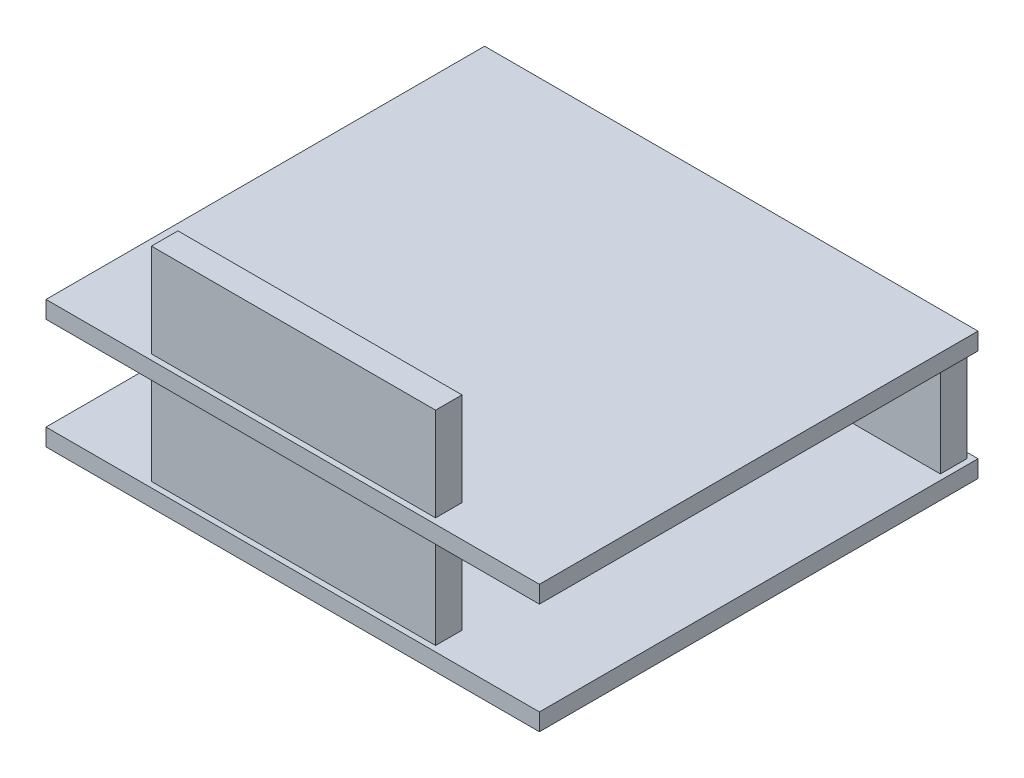
from build123d import *

# Parameters (mm, degrees)
SKETCH1_W           = 45
SKETCH1_H           = 40
BOSS_EXTRUDE1_DEPTH = 1.57
SKETCH2_W           = 25.91
SKETCH2_H           = 2.41
BOSS_EXTRUDE2_DEPTH = 8.51
SKETCH3_W           = 45
SKETCH3_H           = 40
BOSS_EXTRUDE3_DEPTH = 1.57
SKETCH4_W           = 25.91
SKETCH4_H           = 2.41
BOSS_EXTRUDE4_DEPTH = 8.51


with BuildPart() as part:
    # Sketch1 → Boss-Extrude1 (new body)
    with BuildSketch(Plane(origin=(0, 0, 0), x_dir=(1, 0, 0), z_dir=(0, 1, 0))):
        Rectangle(SKETCH1_W, SKETCH1_H)
    extrude(amount=BOSS_EXTRUDE1_DEPTH)

    # Sketch2 → Boss-Extrude2 (add)
    with BuildSketch(Plane(origin=(0, 1.57, 0), x_dir=(1, 0, 0), z_dir=(0, 1, 0))):
        with Locations((9.035, 18.285)):
            Rectangle(SKETCH2_W, SKETCH2_H)
        with Locations((-0.435, -18.285)):
            Rectangle(SKETCH2_W, SKETCH2_H)
    extrude(amount=BOSS_EXTRUDE2_DEPTH)

    # Sketch3 → Boss-Extrude3 (add)
    with BuildSketch(Plane(origin=(0, 10.08, 0), x_dir=(1, 0, 0), z_dir=(0, 1, 0))):
        Rectangle(SKETCH3_W, SKETCH3_H)
    extrude(amount=BOSS_EXTRUDE3_DEPTH)

    # Sketch4 → Boss-Extrude4 (add)
    with BuildSketch(Plane(origin=(0, 11.65, 0), x_dir=(1, 0, 0), z_dir=(0, 1, 0))):
        with Locations((-0.435, -18.285)):
            Rectangle(SKETCH4_W, SKETCH4_H)
    extrude(amount=BOSS_EXTRUDE4_DEPTH)


solid = part.part
